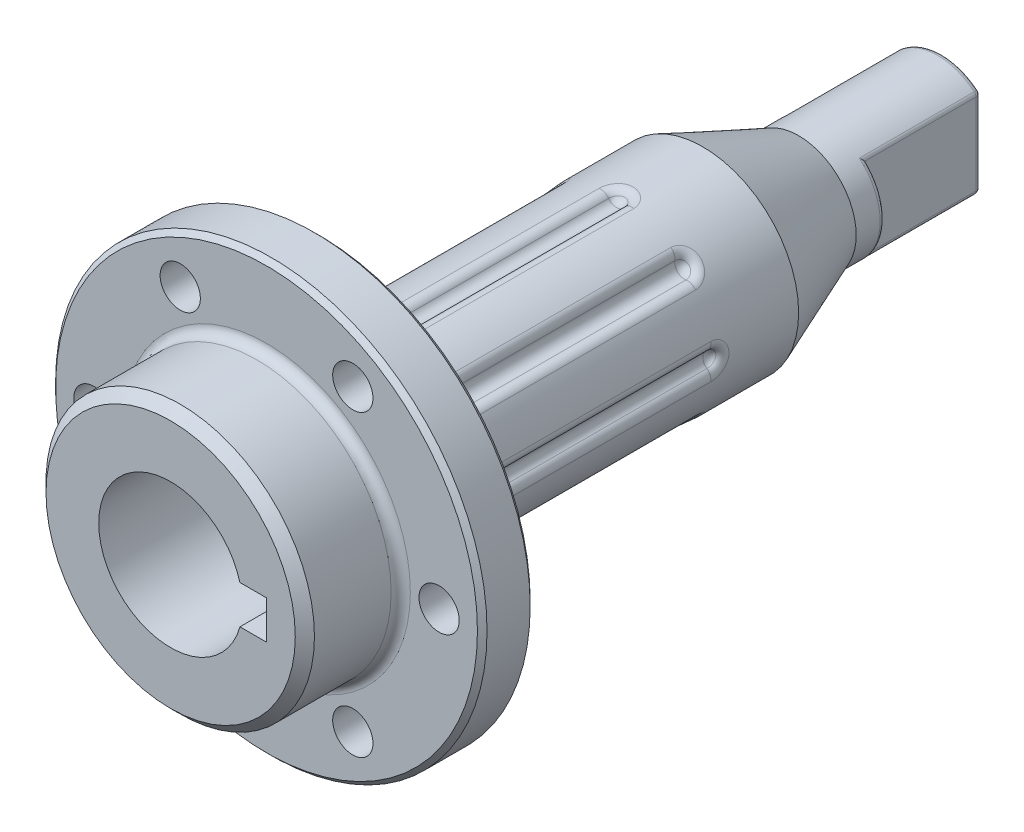
from build123d import *

# Parameters (mm, degrees)
SKETCH1_R                 = 22.5
BOSS_EXTRUDE1_DEPTH       = 2.75
SKETCH2_R                 = 14
BOSS_EXTRUDE2_DEPTH       = 10
CUT_EXTRUDE1_DEPTH        = 13
CUT_EXTRUDE2_DEPTH        = 12
FILLET1_R                 = 1
CIRPATTERN1_COUNT         = 8
FILLET1_OF_CIRPATTERN1_R  = 1
M5X0_8_TAPPED_HOLE1_D     = 4.2
M5X0_8_TAPPED_HOLE1_DEPTH = 14
M5X0_8_TAPPED_HOLE1_TIP   = 1.2618073
FILLET2_R                 = 1
CHAMFER1_SIZE             = 1
CHAMFER2_SIZE             = 0.5
FILLET3_R                 = 0.5


with BuildPart() as part:
    # Sketch1 → Boss-Extrude1 (new, symmetric)
    with BuildSketch(Plane.XY):
        Circle(SKETCH1_R)
    extrude(amount=BOSS_EXTRUDE1_DEPTH, both=True)

    # Sketch2 → Boss-Extrude2 (add)
    with BuildSketch(Plane.XY.offset(2.75)):
        Circle(SKETCH2_R)
    extrude(amount=BOSS_EXTRUDE2_DEPTH)

    # Sketch3 → Cut-Extrude1 (cut)
    with BuildSketch(Plane.XY.offset(12.75)):
        with BuildLine():
            Line((7.228416147, -2), (10, -2))
            Line((10, -2), (10, 2))
            Line((10, 2), (7.228416147, 2))
            ThreePointArc((7.228416147, 2), (-7.5, 0), (7.228416147, -2))
        make_face()
    extrude(amount=-CUT_EXTRUDE1_DEPTH, mode=Mode.SUBTRACT)

    # Sketch4 → Revolve1 (revolve)
    with BuildSketch(Plane(origin=(0, 0, 0), x_dir=(0, 0, -1), z_dir=(1, 0, 0))):
        Polygon((2.75, 10), (42.75, 10), (52.75, 6), (67.75, 6), (67.75, 0), (2.75, 0), align=None)
    revolve(axis=Axis((0, 0, 0), (0, 0, -1)))

    # Sketch5 → Cut-Extrude2 (cut)
    with BuildSketch(Plane(origin=(0, 0, -67.75), x_dir=(-1, 0, 0), z_dir=(0, 0, -1))):
        with BuildLine():
            Line((4, -4.472135955), (4, 4.472135955))
            ThreePointArc((4, 4.472135955), (6, 0), (4, -4.472135955))
        make_face()
        with BuildLine():
            Line((-4, -4.472135955), (-4, 4.472135955))
            ThreePointArc((-4, 4.472135955), (-6, 0), (-4, -4.472135955))
        make_face()
    extrude(amount=-CUT_EXTRUDE2_DEPTH, mode=Mode.SUBTRACT)

    # Sketch6 → Cut-Revolve4 (revolve, cut)
    with BuildSketch(Plane(origin=(0, 0, 0), x_dir=(0, 0, -1), z_dir=(1, 0, 0))):
        with BuildLine():
            Line((33.75, 11), (8.75, 11))
            ThreePointArc((8.75, 11), (8.042893219, 10.707106781), (7.75, 10))
            Line((7.75, 10), (34.75, 10))
            ThreePointArc((34.75, 10), (34.457106781, 10.707106781), (33.75, 11))
        make_face()
    cut_revolve4 = revolve(axis=Axis((0, 10, -33.75), (0, 0, 1)), mode=Mode.SUBTRACT)

    # Fillet1
    fillet1_edges = [part.edges().sort_by_distance(p)[0] for p in [
        (0.706664699, 9.974999968, -34.457106782),
        (-0.998749218, 9.95, -21.25),
        (-0.706664779, 9.974999952, -8.0428933),
        (0.998749218, 9.95, -21.25),
    ]]
    fillet(fillet1_edges, radius=FILLET1_R)

    # CirPattern1: Cut-Revolve4 ×8 about axis
    cirpattern1_axis = Axis((0, 0, 0), (0, 0, 1))
    for i in range(1, CIRPATTERN1_COUNT):
        add(cut_revolve4.rotate(cirpattern1_axis, i * 360 / CIRPATTERN1_COUNT), mode=Mode.SUBTRACT)

    # Fillet1 of CirPattern1
    fillet1_of_cirpattern1_edges = [part.edges().sort_by_distance(p)[0] for p in [
        (-6.553702719, 7.55307752, -34.457106782),
        (-7.741934817, 6.329490128, -21.25),
        (-7.553077566, 6.553702652, -8.0428933),
        (-6.329490128, 7.741934817, -21.25),
        (-9.974999968, 0.706664699, -34.457106782),
        (-9.95, -0.998749218, -21.25),
        (-9.974999952, -0.706664779, -8.0428933),
        (-9.95, 0.998749218, -21.25),
        (-7.55307752, -6.553702719, -34.457106782),
        (-6.329490128, -7.741934817, -21.25),
        (-6.553702652, -7.553077566, -8.0428933),
        (-7.741934817, -6.329490128, -21.25),
        (-0.706664699, -9.974999968, -34.457106782),
        (0.998749218, -9.95, -21.25),
        (0.706664779, -9.974999952, -8.0428933),
        (-0.998749218, -9.95, -21.25),
        (6.553702719, -7.55307752, -34.457106782),
        (7.741934817, -6.329490128, -21.25),
        (7.553077566, -6.553702652, -8.0428933),
        (6.329490128, -7.741934817, -21.25),
        (9.974999968, -0.706664699, -34.457106782),
        (9.95, 0.998749218, -21.25),
        (9.974999952, 0.706664779, -8.0428933),
        (9.95, -0.998749218, -21.25),
        (7.55307752, 6.553702719, -34.457106782),
        (6.329490128, 7.741934817, -21.25),
        (6.553702652, 7.553077566, -8.0428933),
        (7.741934817, 6.329490128, -21.25),
    ]]
    fillet(fillet1_of_cirpattern1_edges, radius=FILLET1_OF_CIRPATTERN1_R)

    # M5x0.8 Tapped Hole1
    with Locations(Plane.XY.offset(2.75)):
        with Locations((-9, -15.588457268), (-18, 0), (-9, 15.588457268), (9, 15.588457268), (18, 0), (9, -15.588457268)):
            Hole(M5X0_8_TAPPED_HOLE1_D / 2, depth=M5X0_8_TAPPED_HOLE1_DEPTH)
            with Locations((0, 0, -(M5X0_8_TAPPED_HOLE1_DEPTH + M5X0_8_TAPPED_HOLE1_TIP / 2))):  # 118° drill point
                Cone(0, M5X0_8_TAPPED_HOLE1_D / 2, M5X0_8_TAPPED_HOLE1_TIP, mode=Mode.SUBTRACT)

    # Fillet2
    fillet2_edges = [part.edges().sort_by_distance(p)[0] for p in [
        (-14, 0, 2.75),
        (0, -10, -2.75),
    ]]
    fillet(fillet2_edges, radius=FILLET2_R)

    # Chamfer1
    chamfer1_edges = [part.edges().sort_by_distance(p)[0] for p in [
        (-14, 0, 12.75),
    ]]
    chamfer(chamfer1_edges, length=CHAMFER1_SIZE)

    # Chamfer2
    chamfer2_edges = [part.edges().sort_by_distance(p)[0] for p in [
        (-22.5, 0, -2.75),
        (-22.5, 0, 2.75),
    ]]
    chamfer(chamfer2_edges, length=CHAMFER2_SIZE)

    # Fillet3
    fillet3_edges = [part.edges().sort_by_distance(p)[0] for p in [
        (4, 4.472135955, -61.75),
        (-4, 4.472135955, -61.75),
        (2.140932539, 5.605034154, -67.75),
        (0, -6, -67.75),
        (-4, -4.472135955, -61.75),
        (-4, 0, -67.75),
        (4, 0, -67.75),
        (4, -4.472135955, -61.75),
        (6, 0, -55.75),
        (-6, 0, -55.75),
    ]]
    fillet(fillet3_edges, radius=FILLET3_R)

    # Sketch11 → Cut-Revolve5 (revolve, cut)
    with BuildSketch(Plane(origin=(0, 0, 0), x_dir=(0, 0, -1), z_dir=(1, 0, 0))):
        Polygon((67.75, 2), (65.75, 0), (67.75, 0), align=None)
    revolve(axis=Axis((0, 0, -67.75), (0, 0, 1)), mode=Mode.SUBTRACT)


solid = part.part
